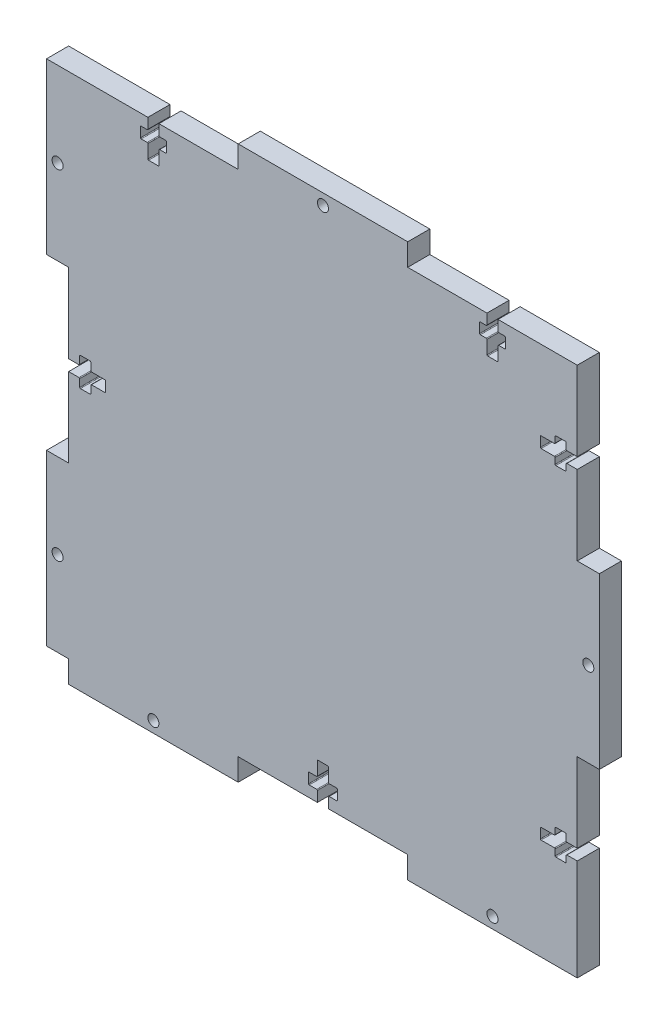
from build123d import *

# Parameters (mm, degrees)
BOX_SIDE_DEPTH       = 6
SKETCH2_R            = 1.5
SCREW_CUT_OUTS_DEPTH = 107.235587258


with BuildPart() as part:
    # Sketch1 → Box Side (new body)
    with BuildSketch(Plane.XY):
        Polygon((-69, 69), (-23, 69), (-23, 75), (23, 75), (23, 69), (69, 69), (69, 23), (75, 23), (75, -23), (69, -23), (69, -69), (69, -75), (23, -75), (23, -69), (-23, -69), (-23, -75), (-69, -75), (-69, -69), (-75, -69), (-75, -23), (-69, -23), (-69, 23), (-75, 23), (-75, 69), align=None)
    extrude(amount=BOX_SIDE_DEPTH)

    # Sketch2 → Screw Cut-outs (cut, through all)
    with BuildSketch(Plane.XY.offset(6)):
        with Locations((0, 72)):
            Circle(SKETCH2_R)
        with Locations((72, 0)):
            Circle(SKETCH2_R)
        with Locations((-46, -72)):
            Circle(SKETCH2_R)
        with Locations((46, -72)):
            Circle(SKETCH2_R)
        with Locations((-72, 46)):
            Circle(SKETCH2_R)
        with Locations((-72, -46)):
            Circle(SKETCH2_R)
        with BuildLine():
            Line((-44.5, 69), (-44.5, 66.2))
            ThreePointArc((-44.5, 66.2), (-44.441421356, 66.058578644), (-44.3, 66))
            Line((-44.3, 66), (-42.7, 66))
            ThreePointArc((-42.7, 66), (-42.558578644, 65.941421356), (-42.5, 65.8))
            Line((-42.5, 65.8), (-42.5, 63.2))
            ThreePointArc((-42.5, 63.2), (-42.558578644, 63.058578644), (-42.7, 63))
            Line((-42.7, 63), (-44.3, 63))
            ThreePointArc((-44.3, 63), (-44.441421356, 62.941421356), (-44.5, 62.8))
            Line((-44.5, 62.8), (-44.5, 59.2))
            ThreePointArc((-44.5, 59.2), (-44.558578644, 59.058578644), (-44.7, 59))
            Line((-44.7, 59), (-47.3, 59))
            ThreePointArc((-47.3, 59), (-47.441421356, 59.058578644), (-47.5, 59.2))
            Line((-47.5, 59.2), (-47.5, 62.8))
            ThreePointArc((-47.5, 62.8), (-47.558578644, 62.941421356), (-47.7, 63))
            Line((-47.7, 63), (-49.3, 63))
            ThreePointArc((-49.3, 63), (-49.441421356, 63.058578644), (-49.5, 63.2))
            Line((-49.5, 63.2), (-49.5, 65.8))
            ThreePointArc((-49.5, 65.8), (-49.441421356, 65.941421356), (-49.3, 66))
            Line((-49.3, 66), (-47.7, 66))
            ThreePointArc((-47.7, 66), (-47.558578644, 66.058578644), (-47.5, 66.2))
            Line((-47.5, 66.2), (-47.5, 69))
            Line((-47.5, 69), (-44.5, 69))
        make_face()
        with BuildLine():
            Line((47.5, 69), (47.5, 66.2))
            ThreePointArc((47.5, 66.2), (47.558578644, 66.058578644), (47.7, 66))
            Line((47.7, 66), (49.3, 66))
            ThreePointArc((49.3, 66), (49.441421356, 65.941421356), (49.5, 65.8))
            Line((49.5, 65.8), (49.5, 63.2))
            ThreePointArc((49.5, 63.2), (49.441421356, 63.058578644), (49.3, 63))
            Line((49.3, 63), (47.7, 63))
            ThreePointArc((47.7, 63), (47.558578644, 62.941421356), (47.5, 62.8))
            Line((47.5, 62.8), (47.5, 59.2))
            ThreePointArc((47.5, 59.2), (47.441421356, 59.058578644), (47.3, 59))
            Line((47.3, 59), (44.7, 59))
            ThreePointArc((44.7, 59), (44.558578644, 59.058578644), (44.5, 59.2))
            Line((44.5, 59.2), (44.5, 62.8))
            ThreePointArc((44.5, 62.8), (44.441421356, 62.941421356), (44.3, 63))
            Line((44.3, 63), (42.7, 63))
            ThreePointArc((42.7, 63), (42.558578644, 63.058578644), (42.5, 63.2))
            Line((42.5, 63.2), (42.5, 65.8))
            ThreePointArc((42.5, 65.8), (42.558578644, 65.941421356), (42.7, 66))
            Line((42.7, 66), (44.3, 66))
            ThreePointArc((44.3, 66), (44.441421356, 66.058578644), (44.5, 66.2))
            Line((44.5, 66.2), (44.5, 69))
            Line((44.5, 69), (47.5, 69))
        make_face()
        with BuildLine():
            Line((69, 44.5), (66.2, 44.5))
            ThreePointArc((66.2, 44.5), (66.058578644, 44.441421356), (66, 44.3))
            Line((66, 44.3), (66, 42.7))
            ThreePointArc((66, 42.7), (65.941421356, 42.558578644), (65.8, 42.5))
            Line((65.8, 42.5), (63.2, 42.5))
            ThreePointArc((63.2, 42.5), (63.058578644, 42.558578644), (63, 42.7))
            Line((63, 42.7), (63, 44.3))
            ThreePointArc((63, 44.3), (62.941421356, 44.441421356), (62.8, 44.5))
            Line((62.8, 44.5), (59.2, 44.5))
            ThreePointArc((59.2, 44.5), (59.058578644, 44.558578644), (59, 44.7))
            Line((59, 44.7), (59, 47.3))
            ThreePointArc((59, 47.3), (59.058578644, 47.441421356), (59.2, 47.5))
            Line((59.2, 47.5), (62.8, 47.5))
            ThreePointArc((62.8, 47.5), (62.941421356, 47.558578644), (63, 47.7))
            Line((63, 47.7), (63, 49.3))
            ThreePointArc((63, 49.3), (63.058578644, 49.441421356), (63.2, 49.5))
            Line((63.2, 49.5), (65.8, 49.5))
            ThreePointArc((65.8, 49.5), (65.941421356, 49.441421356), (66, 49.3))
            Line((66, 49.3), (66, 47.7))
            ThreePointArc((66, 47.7), (66.058578644, 47.558578644), (66.2, 47.5))
            Line((66.2, 47.5), (69, 47.5))
            Line((69, 47.5), (69, 44.5))
        make_face()
        with BuildLine():
            Line((69, -47.5), (66.2, -47.5))
            ThreePointArc((66.2, -47.5), (66.058578644, -47.558578644), (66, -47.7))
            Line((66, -47.7), (66, -49.3))
            ThreePointArc((66, -49.3), (65.941421356, -49.441421356), (65.8, -49.5))
            Line((65.8, -49.5), (63.2, -49.5))
            ThreePointArc((63.2, -49.5), (63.058578644, -49.441421356), (63, -49.3))
            Line((63, -49.3), (63, -47.7))
            ThreePointArc((63, -47.7), (62.941421356, -47.558578644), (62.8, -47.5))
            Line((62.8, -47.5), (59.2, -47.5))
            ThreePointArc((59.2, -47.5), (59.058578644, -47.441421356), (59, -47.3))
            Line((59, -47.3), (59, -44.7))
            ThreePointArc((59, -44.7), (59.058578644, -44.558578644), (59.2, -44.5))
            Line((59.2, -44.5), (62.8, -44.5))
            ThreePointArc((62.8, -44.5), (62.941421356, -44.441421356), (63, -44.3))
            Line((63, -44.3), (63, -42.7))
            ThreePointArc((63, -42.7), (63.058578644, -42.558578644), (63.2, -42.5))
            Line((63.2, -42.5), (65.8, -42.5))
            ThreePointArc((65.8, -42.5), (65.941421356, -42.558578644), (66, -42.7))
            Line((66, -42.7), (66, -44.3))
            ThreePointArc((66, -44.3), (66.058578644, -44.441421356), (66.2, -44.5))
            Line((66.2, -44.5), (69, -44.5))
            Line((69, -44.5), (69, -47.5))
        make_face()
        with BuildLine():
            Line((-1.5, -69), (1.5, -69))
            Line((1.5, -69), (1.5, -66.2))
            ThreePointArc((1.5, -66.2), (1.558578644, -66.058578644), (1.7, -66))
            Line((1.7, -66), (3.7, -66))
            ThreePointArc((3.7, -66), (3.841421356, -65.941421356), (3.9, -65.8))
            Line((3.9, -65.8), (3.9, -63.2))
            ThreePointArc((3.9, -63.2), (3.841421356, -63.058578644), (3.7, -63))
            Line((3.7, -63), (1.7, -63))
            ThreePointArc((1.7, -63), (1.558578644, -62.941421356), (1.5, -62.8))
            Line((1.5, -62.8), (1.5, -59.2))
            ThreePointArc((1.5, -59.2), (1.441421356, -59.058578644), (1.3, -59))
            Line((1.3, -59), (-1.3, -59))
            ThreePointArc((-1.3, -59), (-1.441421356, -59.058578644), (-1.5, -59.2))
            Line((-1.5, -59.2), (-1.5, -62.8))
            ThreePointArc((-1.5, -62.8), (-1.558578644, -62.941421356), (-1.7, -63))
            Line((-1.7, -63), (-3.7, -63))
            ThreePointArc((-3.7, -63), (-3.841421356, -63.058578644), (-3.9, -63.2))
            Line((-3.9, -63.2), (-3.9, -65.8))
            ThreePointArc((-3.9, -65.8), (-3.841421356, -65.941421356), (-3.7, -66))
            Line((-3.7, -66), (-1.7, -66))
            ThreePointArc((-1.7, -66), (-1.558578644, -66.058578644), (-1.5, -66.2))
            Line((-1.5, -66.2), (-1.5, -69))
        make_face()
        with BuildLine():
            Line((-69, -1.5), (-66.2, -1.5))
            ThreePointArc((-66.2, -1.5), (-66.058578644, -1.558578644), (-66, -1.7))
            Line((-66, -1.7), (-66, -3.7))
            ThreePointArc((-66, -3.7), (-65.941421356, -3.841421356), (-65.8, -3.9))
            Line((-65.8, -3.9), (-63.2, -3.9))
            ThreePointArc((-63.2, -3.9), (-63.058578644, -3.841421356), (-63, -3.7))
            Line((-63, -3.7), (-63, -1.7))
            ThreePointArc((-63, -1.7), (-62.941421356, -1.558578644), (-62.8, -1.5))
            Line((-62.8, -1.5), (-59.2, -1.5))
            ThreePointArc((-59.2, -1.5), (-59.058578644, -1.441421356), (-59, -1.3))
            Line((-59, -1.3), (-59, 1.3))
            ThreePointArc((-59, 1.3), (-59.058578644, 1.441421356), (-59.2, 1.5))
            Line((-59.2, 1.5), (-62.8, 1.5))
            ThreePointArc((-62.8, 1.5), (-62.941421356, 1.558578644), (-63, 1.7))
            Line((-63, 1.7), (-63, 3.7))
            ThreePointArc((-63, 3.7), (-63.058578644, 3.841421356), (-63.2, 3.9))
            Line((-63.2, 3.9), (-65.8, 3.9))
            ThreePointArc((-65.8, 3.9), (-65.941421356, 3.841421356), (-66, 3.7))
            Line((-66, 3.7), (-66, 1.7))
            ThreePointArc((-66, 1.7), (-66.058578644, 1.558578644), (-66.2, 1.5))
            Line((-66.2, 1.5), (-69, 1.5))
            Line((-69, 1.5), (-69, -1.5))
        make_face()
    extrude(amount=-SCREW_CUT_OUTS_DEPTH, mode=Mode.SUBTRACT)


solid = part.part
